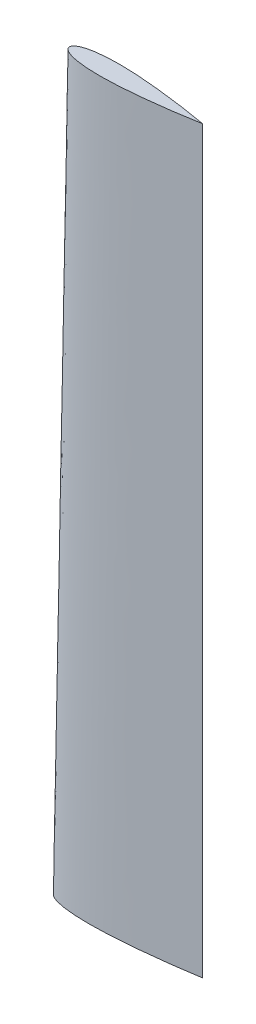
from build123d import *


with BuildPart() as part:
    # Sketch2 → Loft1 section 0
    with BuildSketch(Plane(origin=(0, 0, 0), x_dir=(1, 0, 0), z_dir=(0, 1, 0))):
        with BuildLine():
            Line((0, 0), (500, 0))
            add(Edge.make_bspline(
                [(0, 0), (-0.000102193, 0.466856692), (0.045892755, 1.205240333), (0.218623458, 2.260323184), (0.639894341, 3.618039878), (1.194138446, 4.872754222), (2.012118167, 6.257916161), (3.19048703, 7.80750466), (4.916053805, 9.59698689), (7.508241822, 11.725889954), (11.533360339, 14.323099079), (17.8510135, 17.464609175), (27.921464042, 21.21831602), (43.673058214, 25.412472479), (67.355996863, 29.572834903), (98.015328458, 32.580845181), (133.890821818, 33.979888717), (167.797441089, 33.790758688), (196.840286708, 32.847795288), (221.024268942, 31.635734681), (240.358730199, 30.443517709), (259.679986043, 29.054094921), (278.987909847, 27.489686416), (298.282066855, 25.76756892), (317.563406794, 23.90189177), (336.83045617, 21.903639873), (356.08577656, 19.780461284), (375.324823314, 17.538319129), (394.554601283, 15.178839871), (411.360309064, 13.013900033), (425.767582619, 11.082551124), (437.747544649, 9.425862652), (447.361581937, 8.064050529), (456.901225664, 6.682075449), (466.561907119, 5.247076319), (475.995248073, 3.81498657), (484.611110863, 2.471774803), (491.390506781, 1.396550379), (496.720725016, 0.534604977), (498.912960902, 0.177751274), (500, 0)],
                knots=[0, 0, 0, 0, 0, 0.003309318, 0.00525943, 0.007568824, 0.010082208, 0.013037092, 0.016667906, 0.021375126, 0.027712613, 0.036828199, 0.050646685, 0.071429864, 0.103979311, 0.152532272, 0.221374792, 0.290217325, 0.359059858, 0.393481125, 0.427902392, 0.462323659, 0.496744925, 0.531166193, 0.56558746, 0.600008727, 0.634429995, 0.668851261, 0.703272528, 0.737693795, 0.772115061, 0.789325695, 0.806536328, 0.823746962, 0.840957595, 0.85816823, 0.875378864, 0.892589498, 0.901194815, 0.909800132, 0.909800132, 0.909800132, 0.909800132, 0.909800132], degree=4))
        make_face()
    # Sketch3 → Loft1 section 1
    with BuildSketch(Plane(origin=(0, 2500, 0), x_dir=(1, 0, 0), z_dir=(0, 1, 0))):
        with BuildLine():
            Line((49.997257071, 0), (499.997257071, 0))
            add(Edge.make_bspline(
                [(49.997257071, 0), (49.997113837, 0.489611797), (50.043682491, 1.281000031), (50.222891877, 2.425165964), (50.670268452, 3.913402545), (51.269889471, 5.295071511), (52.147966573, 6.801674986), (53.392673232, 8.459502998), (55.182513852, 10.345013042), (57.836119978, 12.563801618), (61.857176975, 15.21275751), (67.982101842, 18.338443307), (77.479819082, 21.99841074), (91.73645799, 25.95027929), (112.958423036, 29.881506222), (140.330327152, 32.715684737), (167.933451775, 33.828294001), (193.980697229, 33.824589882), (220.016068753, 33.153406637), (241.695685255, 32.114362952), (263.352287218, 30.690580403), (284.984725055, 28.944664347), (302.275919252, 27.376286035), (319.552125983, 25.653056442), (336.814114385, 23.788822188), (351.904757615, 22.043564443), (364.831777647, 20.470759805), (375.596008265, 19.110946776), (384.207243058, 17.993247368), (394.958827818, 16.561427416), (407.866925461, 14.783370227), (422.890625411, 12.629941018), (440.08235947, 10.045703451), (455.054844443, 7.689395363), (467.95825581, 5.576155563), (478.569764859, 3.784385425), (486.227902157, 2.457745663), (492.313225716, 1.384988639), (497.066593708, 0.530869992), (499.02583913, 0.176494497), (499.997257071, 0)],
                knots=[0, 0, 0, 0, 0, 0.003840944, 0.006235023, 0.009072291, 0.01219322, 0.015656839, 0.019917177, 0.025338962, 0.032592504, 0.042799388, 0.05770457, 0.079310668, 0.112503101, 0.158972616, 0.227236465, 0.295500326, 0.329632258, 0.36376419, 0.432028053, 0.466159984, 0.500291915, 0.534423847, 0.56855578, 0.602687711, 0.636819643, 0.653885609, 0.670951575, 0.688017542, 0.705083508, 0.739215439, 0.773347371, 0.807479302, 0.841611234, 0.8586772, 0.875743167, 0.892809133, 0.901342117, 0.9098751, 0.9098751, 0.9098751, 0.9098751, 0.9098751], degree=4))
        make_face()
    loft1 = loft()

    # Mirror1: Loft1 across plane
    add(loft1.mirror(Plane.XY))


solid = part.part
